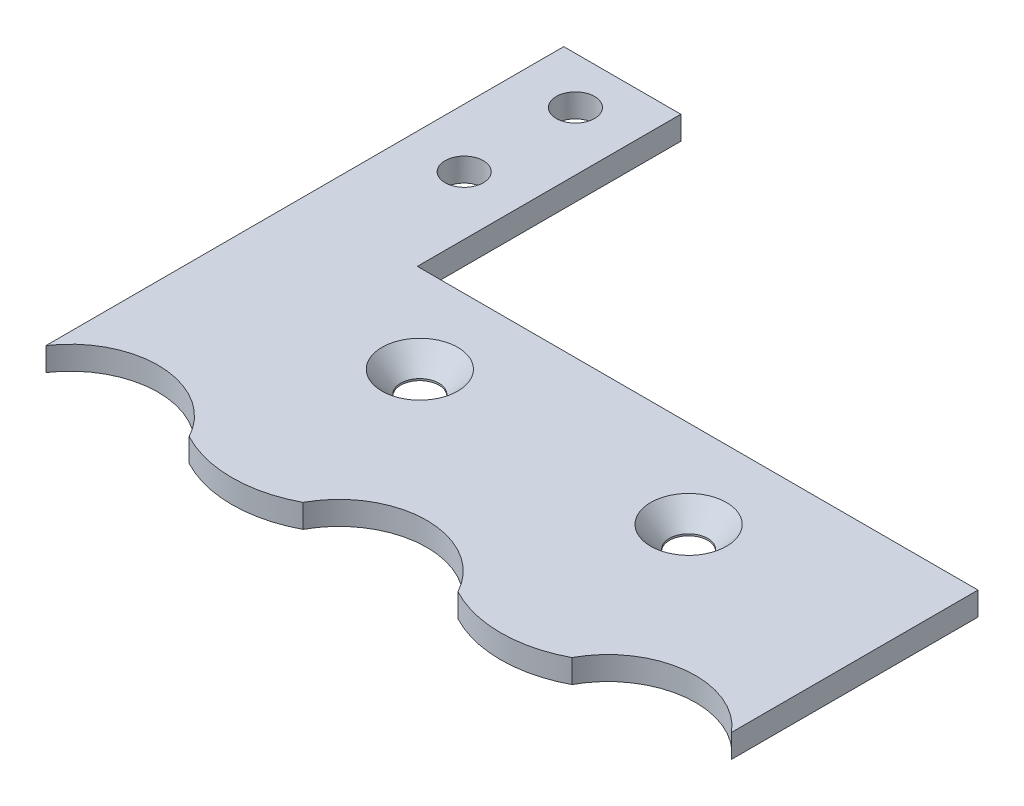
from build123d import *

# Parameters (mm, degrees)
BASE_FLANGE1_START                            = -2
BASE_FLANGE1_DEPTH                            = 2
SKETCH8_R                                     = 1.635
CUT_EXTRUDE1_DEPTH                            = 2
CSK_FOR_4_FLAT_HEAD_SOCKET_CAP_SCREW1_A_COUNT = 2
CSK_FOR_4_FLAT_HEAD_SOCKET_CAP_SCREW1_A_PITCH = 22.95
CUT_EXTRUDE2_DEPTH                            = 2


# Read off the part's stored shape, not the designer's step: Base-Flange1
with BuildPart() as part:
    # Base-Flange1 outline → Base-Flange1 (new body)
    with BuildSketch(Plane(origin=(0, 0, 0), x_dir=(1, 0, 0), z_dir=(0, 1, 0)).offset(BASE_FLANGE1_START)):
        with BuildLine():
            ThreePointArc((-29.187643745, 3.176759435), (-22.95, 7), (-16.712356255, 3.176759435))
            ThreePointArc((-16.712356255, 3.176759435), (-11.475, 1.832537182), (-6.237643745, 3.176759435))
            ThreePointArc((-6.237643745, 3.176759435), (0, 7), (6.237643745, 3.176759435))
            ThreePointArc((6.237643745, 3.176759435), (11.475, 1.832537182), (16.712356255, 3.176759435))
            ThreePointArc((16.712356255, 3.176759435), (22.95, 7), (29.187643745, 3.176759435))
            Line((29.187643745, 3.176759435), (29.187643745, 25.875))
            Line((29.187643745, 25.875), (-19.187643745, 25.875))
            Line((-19.187643745, 25.875), (-19.187643745, 48.375))
            Line((-19.187643745, 48.375), (-29.187643745, 48.375))
            Line((-29.187643745, 48.375), (-29.187643745, 3.176759435))
        make_face()
    extrude(amount=BASE_FLANGE1_DEPTH)

    # Sketch8 → Cut-Extrude1 (cut)
    with BuildSketch(Plane(origin=(0, 0, 0), x_dir=(1, 0, 0), z_dir=(0, 1, 0))):
        with Locations(Location((-24.187643745, 44.375, 0), (0, 0, 270))):
            Circle(SKETCH8_R)
        with Locations(Location((-24.187643745, 34.875, 0), (0, 0, 270))):
            Circle(SKETCH8_R)
    extrude(amount=-CUT_EXTRUDE1_DEPTH, mode=Mode.SUBTRACT)

    # Sketch10 → CSK for #4 Flat Head Socket Cap Screw1 (revolve, cut)
    with BuildSketch(Plane(origin=(11.475, 0, -18.375), x_dir=(0, 0, 1), z_dir=(1, 0, 0))):
        Polygon((0, 0), (0, 2.980574487), (1.63195, 2), (1.63195, 1.848124365), (3.2385, 0), align=None)
    csk_for_4_flat_head_socket_cap_screw1 = revolve(axis=Axis((11.475, 6.35, -18.375), (0, -1, 0)), mode=Mode.SUBTRACT)

    # CSK for #4 Flat Head Socket Cap Screw1 a: CSK for #4 Flat Head Socket Cap Screw1 ×2
    with Locations(*[(-i * CSK_FOR_4_FLAT_HEAD_SOCKET_CAP_SCREW1_A_PITCH, 0, 0) for i in range(1, CSK_FOR_4_FLAT_HEAD_SOCKET_CAP_SCREW1_A_COUNT)]):
        add(csk_for_4_flat_head_socket_cap_screw1, mode=Mode.SUBTRACT)

    # Sketch12 → Cut-Extrude2 (cut)
    with BuildSketch(Plane(origin=(0, 0, 0), x_dir=(1, 0, 0), z_dir=(0, 1, 0))):
        with BuildLine():
            Line((-29.633189727, 3.403670823), (-29.633189727, -1.121913875))
            Line((-29.633189727, -1.121913875), (35.30589457, -1.121913875))
            Line((35.30589457, -1.121913875), (35.30589457, 25.875))
            Line((35.30589457, 25.875), (28.687643745, 25.875))
            Line((28.687643745, 25.875), (28.687643745, 4.83005634))
            ThreePointArc((28.687643745, 4.83005634), (22.173017349, 7.459644627), (16.340134062, 3.543962794))
            ThreePointArc((16.340134062, 3.543962794), (11.475, 2.332537182), (6.609865938, 3.543962794))
            ThreePointArc((6.609865938, 3.543962794), (0, 7.5), (-6.609865938, 3.543962794))
            ThreePointArc((-6.609865938, 3.543962794), (-11.475, 2.332537182), (-16.340134062, 3.543962794))
            ThreePointArc((-16.340134062, 3.543962794), (-23.029148934, 7.499582351), (-29.633189727, 3.403670823))
        make_face()
    extrude(amount=-CUT_EXTRUDE2_DEPTH, mode=Mode.SUBTRACT)


solid = part.part
